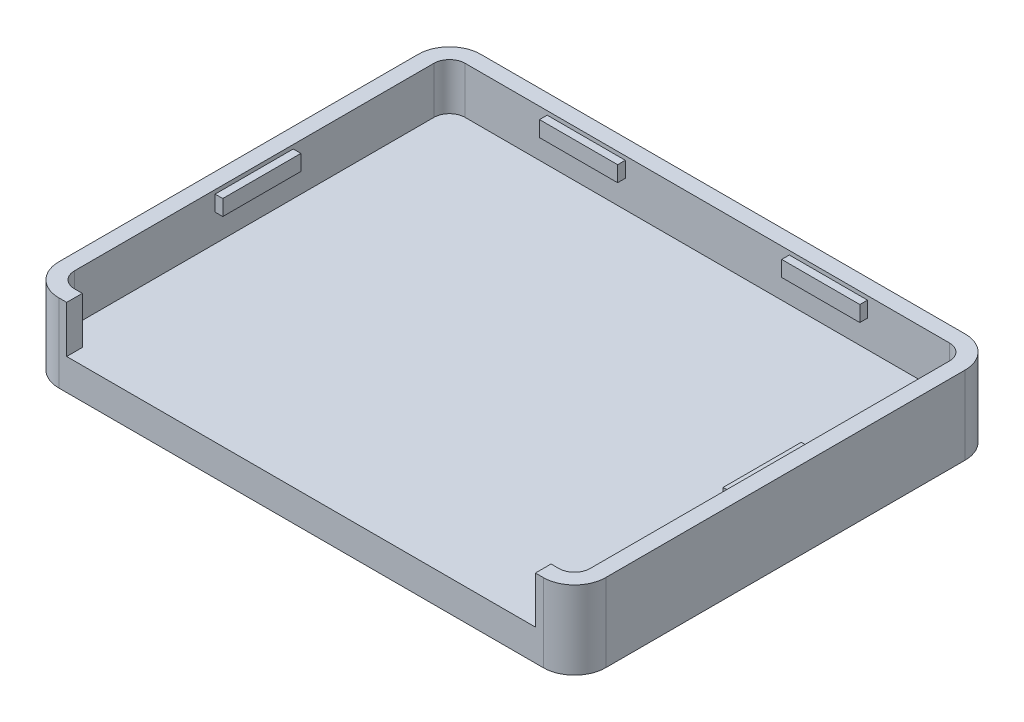
from build123d import *

# Parameters (mm, degrees)
BOSS_EXTRU_1_DEPTH      = 5
ENL_V_MAT_EXTRU_1_DEPTH = 3
ESQUISSE3_W             = 30
ESQUISSE3_H             = 3
ENL_V_MAT_EXTRU_2_DEPTH = 3
ESQUISSE4_W             = 5
ESQUISSE4_H             = 1
BOSS_EXTRU_2_DEPTH      = 0.48904
ESQUISSE5_W             = 5
ESQUISSE5_H             = 1
BOSS_EXTRU_3_DEPTH      = 0.48904
ESQUISSE6_W             = 5
ESQUISSE6_H             = 1
BOSS_EXTRU_4_DEPTH      = 0.48904


with BuildPart() as part:
    # Esquisse1 → Boss.-Extru.1 (new body)
    with BuildSketch(Plane(origin=(0, 0, 0), x_dir=(1, 0, 0), z_dir=(0, 1, 0))):
        with BuildLine():
            Line((2, 0), (33, 0))
            ThreePointArc((33, 0), (34.414213562, 0.585786438), (35, 2))
            Line((35, 2), (35, 25))
            ThreePointArc((35, 25), (34.414213562, 26.414213562), (33, 27))
            Line((33, 27), (2, 27))
            ThreePointArc((2, 27), (0.585786438, 26.414213562), (0, 25))
            Line((0, 25), (0, 2))
            ThreePointArc((0, 2), (0.585786438, 0.585786438), (2, 0))
        make_face()
    extrude(amount=BOSS_EXTRU_1_DEPTH)

    # Esquisse2 → Enlèv. mat.-Extru.1 (cut)
    with BuildSketch(Plane(origin=(0, 5, 0), x_dir=(1, 0, 0), z_dir=(0, 1, 0))):
        with BuildLine():
            Line((34, 2), (34, 25))
            ThreePointArc((34, 25), (33.707106781, 25.707106781), (33, 26))
            Line((33, 26), (2, 26))
            ThreePointArc((2, 26), (1.292893219, 25.707106781), (1, 25))
            Line((1, 25), (1, 2))
            ThreePointArc((1, 2), (1.292893219, 1.292893219), (2, 1))
            Line((2, 1), (33, 1))
            ThreePointArc((33, 1), (33.707106781, 1.292893219), (34, 2))
        make_face()
    extrude(amount=-ENL_V_MAT_EXTRU_1_DEPTH, mode=Mode.SUBTRACT)

    # Esquisse3 → Enlèv. mat.-Extru.2 (cut)
    with BuildSketch(Plane.XY):
        with Locations((17.5, 3.5)):
            Rectangle(ESQUISSE3_W, ESQUISSE3_H)
    extrude(amount=-ENL_V_MAT_EXTRU_2_DEPTH, mode=Mode.SUBTRACT)

    # Esquisse4 → Boss.-Extru.2 (add)
    with BuildSketch(Plane(origin=(1, 0, 0), x_dir=(0, 0, -1), z_dir=(1, 0, 0))):
        with Locations((13.5, 4.25)):
            Rectangle(ESQUISSE4_W, ESQUISSE4_H)
    extrude(amount=BOSS_EXTRU_2_DEPTH)

    # Esquisse5 → Boss.-Extru.3 (add)
    with BuildSketch(Plane.ZY.offset(-34)):
        with Locations((-13.5, 4.25)):
            Rectangle(ESQUISSE5_W, ESQUISSE5_H)
    extrude(amount=BOSS_EXTRU_3_DEPTH)

    # Esquisse6 → Boss.-Extru.4 (add)
    with BuildSketch(Plane.XY.offset(-26)):
        with Locations((9.75, 4.25)):
            Rectangle(ESQUISSE6_W, ESQUISSE6_H)
        with Locations((25.25, 4.25)):
            Rectangle(ESQUISSE6_W, ESQUISSE6_H)
    extrude(amount=BOSS_EXTRU_4_DEPTH)


solid = part.part
